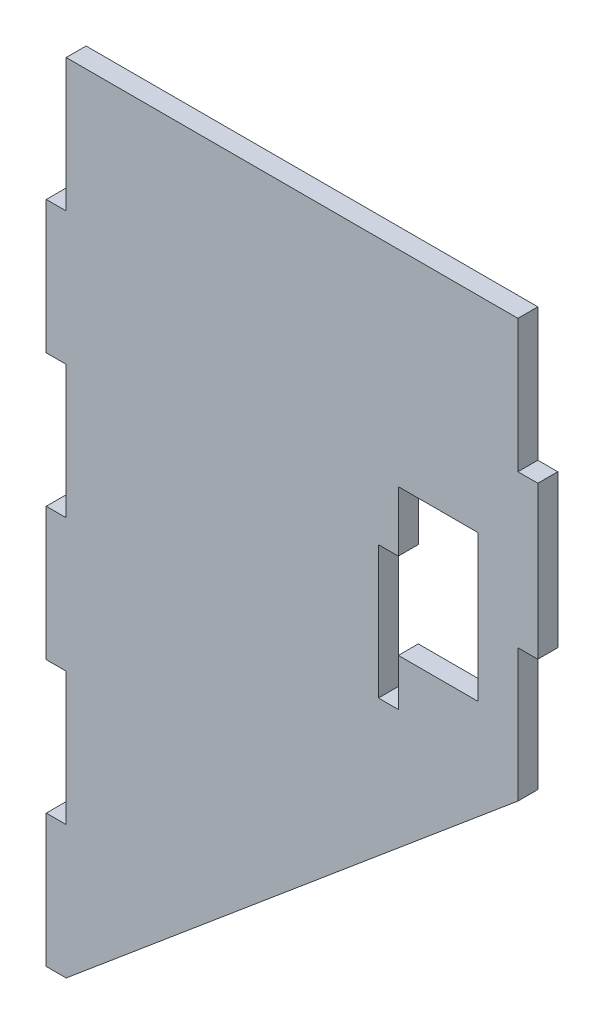
from build123d import *

# Parameters (mm, degrees)
BOSS_EXTRUDE1_DEPTH = 3


with BuildPart() as part:
    # Sketch1 → Boss-Extrude1 (new body)
    with BuildSketch(Plane.XY):
        Polygon((-3, 60), (-3, 40), (0, 40), (0, 20), (-3, 20), (-3, 0), (0, 0), (68, 57.05877492), (68, 77.05877492), (71, 77.05877492), (71, 100), (68, 100), (68, 120), (23.5, 120), (0, 120), (0, 100), (-3, 100), (-3, 80), (0, 80), (0, 60), align=None)
        Polygon((47, 80), (50, 80), (50, 89.05877492), (62, 89.05877492), (62, 67.05877492), (50, 67.05877492), (50, 60), (47, 60), align=None, mode=Mode.SUBTRACT)
    extrude(amount=BOSS_EXTRUDE1_DEPTH)


solid = part.part
